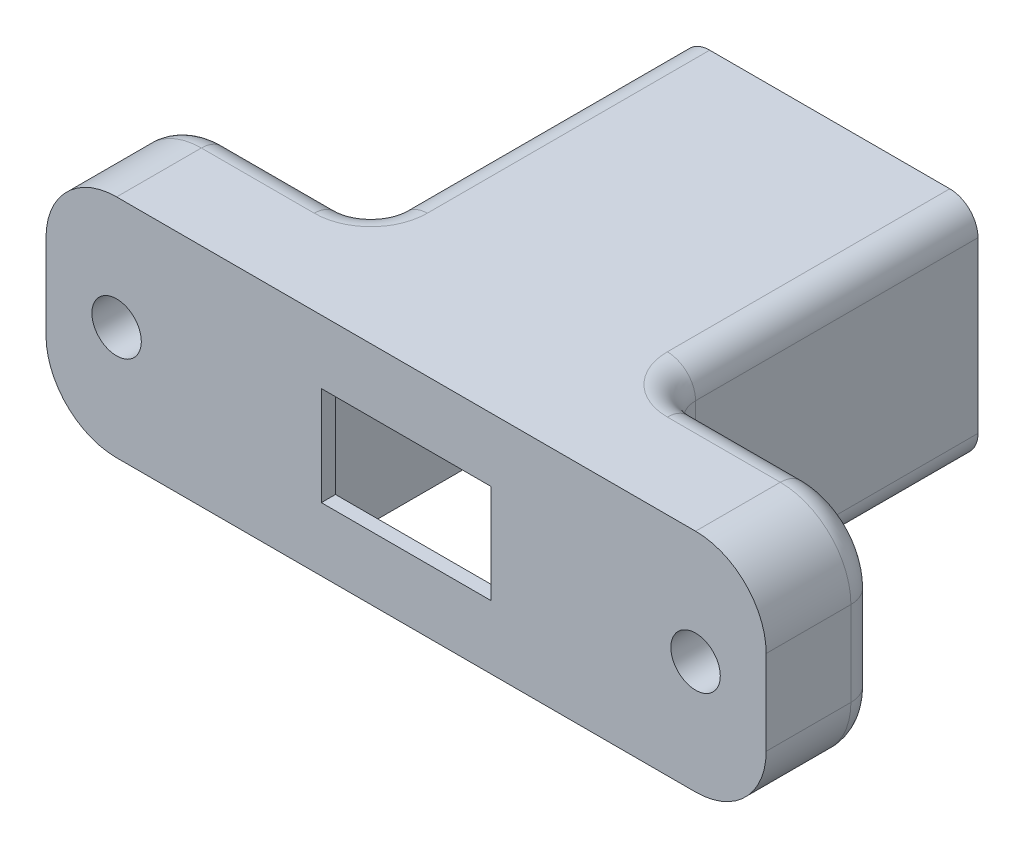
from build123d import *

# Parameters (mm, degrees)
SKETCH1_W           = 15
SKETCH1_H           = 10
SKETCH1_W_2         = 12
SKETCH1_H_2         = 7
SKETCH1_H_3         = 3
SKETCH1_R           = 1.75
BOSS_EXTRUDE1_DEPTH = 1
BOSS_EXTRUDE2_DEPTH = 24
BOSS_EXTRUDE3_START = -7
SKETCH1_5_R         = 1.75
BOSS_EXTRUDE3_DEPTH = 7
BOSS_EXTRUDE4_DEPTH = 5
CUT_EXTRUDE1_DEPTH  = 20
FILLET1_R           = 2


with BuildPart() as part:
    # Sketch1 → Boss-Extrude1 (new body)
    # profile 1 of 7: a face of its own
    with BuildSketch(Plane.XY):
        with Locations((7.5, 5)):
            Rectangle(SKETCH1_W, SKETCH1_H)
        with Locations((7.5, 5)):
            Rectangle(SKETCH1_W_2, SKETCH1_H_2, mode=Mode.SUBTRACT)
    # profile 2 of 7: a face of its own
    with BuildSketch(Plane.XY):
        with Locations((7.5, -1.5)):
            Rectangle(SKETCH1_W, SKETCH1_H_3)
    # profile 3 of 7: a face of its own
    with BuildSketch(Plane.XY):
        Polygon((0, -3), (0, 0), (0, 10), (15, 10), (15, 0), (15, -3), (18, -3), (18, 13), (-3, 13), (-3, -3), align=None)
    # profile 4 of 7: a face of its own
    with BuildSketch(Plane.XY):
        with BuildLine():
            Line((-13, -3), (-3, -3))
            Line((-3, -3), (-3, 13))
            Line((-3, 13), (-13, 13))
            ThreePointArc((-13, 13), (-16.535533906, 11.535533906), (-18, 8))
            Line((-18, 8), (-18, 2))
            ThreePointArc((-18, 2), (-16.535533906, -1.535533906), (-13, -3))
        make_face()
        Polygon((-11.383419246, 7.8), (-9.766838493, 5), (-11.383419246, 2.2), (-14.616580754, 2.2), (-16.233161507, 5), (-14.616580754, 7.8), align=None, mode=Mode.SUBTRACT)
    # profile 5 of 7: a face of its own
    with BuildSketch(Plane.XY):
        Polygon((-14.616580754, 2.2), (-11.383419246, 2.2), (-9.766838493, 5), (-11.383419246, 7.8), (-14.616580754, 7.8), (-16.233161507, 5), align=None)
        with Locations((-13, 5)):
            Circle(SKETCH1_R, mode=Mode.SUBTRACT)
    # profile 6 of 7: a face of its own
    with BuildSketch(Plane.XY):
        with BuildLine():
            Line((18, 13), (18, -3))
            Line((18, -3), (28, -3))
            ThreePointArc((28, -3), (31.535533906, -1.535533906), (33, 2))
            Line((33, 2), (33, 8))
            ThreePointArc((33, 8), (31.535533906, 11.535533906), (28, 13))
            Line((28, 13), (18, 13))
        make_face()
        Polygon((26.383419246, 2.2), (24.766838493, 5), (26.383419246, 7.8), (29.616580754, 7.8), (31.233161507, 5), (29.616580754, 2.2), align=None, mode=Mode.SUBTRACT)
    # profile 7 of 7: a face of its own
    with BuildSketch(Plane.XY):
        Polygon((29.616580754, 7.8), (26.383419246, 7.8), (24.766838493, 5), (26.383419246, 2.2), (29.616580754, 2.2), (31.233161507, 5), align=None)
        with Locations((28, 5)):
            Circle(SKETCH1_R, mode=Mode.SUBTRACT)
    extrude(amount=BOSS_EXTRUDE1_DEPTH)

    # Sketch1<4> → Boss-Extrude2 (add)
    with BuildSketch(Plane.XY):
        Polygon((0, -3), (0, 0), (0, 10), (15, 10), (15, 0), (15, -3), (18, -3), (18, 13), (-3, 13), (-3, -3), align=None)
    extrude(amount=-BOSS_EXTRUDE2_DEPTH)

    # Sketch1<5> → Boss-Extrude3 (add)
    # profile 1 of 4: a face of its own
    with BuildSketch(Plane.XY.offset(BOSS_EXTRUDE3_START)):
        with BuildLine():
            Line((18, 13), (18, -3))
            Line((18, -3), (28, -3))
            ThreePointArc((28, -3), (31.535533906, -1.535533906), (33, 2))
            Line((33, 2), (33, 8))
            ThreePointArc((33, 8), (31.535533906, 11.535533906), (28, 13))
            Line((28, 13), (18, 13))
        make_face()
        Polygon((26.383419246, 2.2), (24.766838493, 5), (26.383419246, 7.8), (29.616580754, 7.8), (31.233161507, 5), (29.616580754, 2.2), align=None, mode=Mode.SUBTRACT)
    # profile 2 of 4: a face of its own
    with BuildSketch(Plane.XY.offset(BOSS_EXTRUDE3_START)):
        Polygon((29.616580754, 7.8), (26.383419246, 7.8), (24.766838493, 5), (26.383419246, 2.2), (29.616580754, 2.2), (31.233161507, 5), align=None)
        with Locations((28, 5)):
            Circle(SKETCH1_5_R, mode=Mode.SUBTRACT)
    # profile 3 of 4: a face of its own
    with BuildSketch(Plane.XY.offset(BOSS_EXTRUDE3_START)):
        with BuildLine():
            Line((-13, -3), (-3, -3))
            Line((-3, -3), (-3, 13))
            Line((-3, 13), (-13, 13))
            ThreePointArc((-13, 13), (-16.535533906, 11.535533906), (-18, 8))
            Line((-18, 8), (-18, 2))
            ThreePointArc((-18, 2), (-16.535533906, -1.535533906), (-13, -3))
        make_face()
        Polygon((-11.383419246, 7.8), (-9.766838493, 5), (-11.383419246, 2.2), (-14.616580754, 2.2), (-16.233161507, 5), (-14.616580754, 7.8), align=None, mode=Mode.SUBTRACT)
    # profile 4 of 4: a face of its own
    with BuildSketch(Plane.XY.offset(BOSS_EXTRUDE3_START)):
        Polygon((-14.616580754, 2.2), (-11.383419246, 2.2), (-9.766838493, 5), (-11.383419246, 7.8), (-14.616580754, 7.8), (-16.233161507, 5), align=None)
        with Locations((-13, 5)):
            Circle(SKETCH1_5_R, mode=Mode.SUBTRACT)
    extrude(amount=BOSS_EXTRUDE3_DEPTH)

    # Sketch2 → Boss-Extrude4 (add)
    with BuildSketch(Plane(origin=(0, 0, -24), x_dir=(-1, 0, 0), z_dir=(0, 0, -1))):
        Polygon((-18, -3), (-15, -3), (-15, 10), (0, 10), (0, -3), (3, -3), (3, 13), (-18, 13), align=None)
        Polygon((-4.316136934, 6.453621675), (0, -3), (0, 10), (-5.935268204, 10), align=None)
        Polygon((-15, 10), (-15, -3), (-10.683863071, 6.453621665), (-9.064731796, 10), align=None)
    extrude(amount=BOSS_EXTRUDE4_DEPTH)

    # Sketch2<4> → Cut-Extrude1 (cut)
    with BuildSketch(Plane(origin=(0, 0, -24), x_dir=(-1, 0, 0), z_dir=(0, 0, -1))):
        Polygon((14.616580754, 7.8), (11.383419246, 7.8), (9.766838493, 5), (11.383419246, 2.2), (14.616580754, 2.2), (16.233161507, 5), align=None)
        Polygon((-29.616580754, 2.2), (-26.383419246, 2.2), (-24.766838493, 5), (-26.383419246, 7.8), (-29.616580754, 7.8), (-31.233161507, 5), align=None)
    extrude(amount=-CUT_EXTRUDE1_DEPTH, mode=Mode.SUBTRACT)

    # Fillet1
    # the kernel refuses this fillet: 2 mm, written as the material it adds along each edge
    with BuildSketch(Plane(origin=(18, 13, -7), x_dir=(1, 0, 0), z_dir=(0, -1, 0)), Plane(origin=(-3, -3, -7), x_dir=(-1, 0, 0), z_dir=(0, 1, 0))) as fillet1_piece_1:
        with BuildLine():
            CenterArc((FILLET1_R, -FILLET1_R), FILLET1_R, 90, 90)
            Line((0, -FILLET1_R), (0, 0))
            Line((0, 0), (FILLET1_R, 0))
        make_face()
    extrude(amount=16)
    # the kernel refuses this fillet: 2 mm, written as the material it takes off along each edge
    with BuildSketch(Plane(origin=(-3, -3, -9), x_dir=(1, 0, 0), z_dir=(0, 0, -1)), Plane(origin=(-3, 13, -34), x_dir=(1, 0, 0), z_dir=(0, 0, 1)), Plane(origin=(18, 13, -9), x_dir=(-1, 0, 0), z_dir=(0, 0, -1)), Plane(origin=(18, -3, -34), x_dir=(-1, 0, 0), z_dir=(0, 0, 1))) as fillet1_2_piece_1:
        with BuildLine():
            CenterArc((FILLET1_R, -FILLET1_R), FILLET1_R, 90, 90)
            Line((0, -FILLET1_R), (0, 0))
            Line((0, 0), (FILLET1_R, 0))
        make_face()
    extrude(amount=25, mode=Mode.SUBTRACT)
    with BuildSketch(Plane(origin=(28, 2, -7), x_dir=(0, -1, 0), z_dir=(-1, 0, 0))) as fillet1_2_piece_2:
        with BuildLine():
            CenterArc((5 - FILLET1_R, FILLET1_R), FILLET1_R, 270, 90)
            Line((5 - FILLET1_R, 0), (5, 0))
            Line((5, 0), (5, FILLET1_R))
        make_face()
    revolve(axis=Axis((28, 2, -7), (0, 0, 1)), revolution_arc=90, mode=Mode.SUBTRACT)
    with BuildSketch(Plane(origin=(20, -3, -7), x_dir=(0, 0, 1), z_dir=(1, 0, 0)), Plane(origin=(28, 13, -7), x_dir=(0, 0, 1), z_dir=(-1, 0, 0)), Plane(origin=(-13, -3, -7), x_dir=(0, 0, 1), z_dir=(1, 0, 0)), Plane(origin=(-5, 13, -7), x_dir=(0, 0, 1), z_dir=(-1, 0, 0))) as fillet1_2_piece_3:
        with BuildLine():
            CenterArc((FILLET1_R, -FILLET1_R), FILLET1_R, 90, 90)
            Line((0, -FILLET1_R), (0, 0))
            Line((0, 0), (FILLET1_R, 0))
        make_face()
    extrude(amount=8, mode=Mode.SUBTRACT)
    with BuildSketch(Plane(origin=(28, 8, -7), x_dir=(1, 0, 0), z_dir=(0, -1, 0))) as fillet1_2_piece_4:
        with BuildLine():
            CenterArc((5 - FILLET1_R, FILLET1_R), FILLET1_R, 270, 90)
            Line((5 - FILLET1_R, 0), (5, 0))
            Line((5, 0), (5, FILLET1_R))
        make_face()
    revolve(axis=Axis((28, 8, -7), (0, 0, 1)), revolution_arc=90, mode=Mode.SUBTRACT)
    with BuildSketch(Plane(origin=(33, 2, -7), x_dir=(0, 0, 1), z_dir=(0, 1, 0)), Plane(origin=(-18, 8, -7), x_dir=(0, 0, 1), z_dir=(0, -1, 0))) as fillet1_2_piece_5:
        with BuildLine():
            CenterArc((FILLET1_R, -FILLET1_R), FILLET1_R, 90, 90)
            Line((0, -FILLET1_R), (0, 0))
            Line((0, 0), (FILLET1_R, 0))
        make_face()
    extrude(amount=6, mode=Mode.SUBTRACT)
    with BuildSketch(Plane(origin=(-13, 2, -7), x_dir=(-1, 0, 0), z_dir=(0, 1, 0))) as fillet1_2_piece_6:
        with BuildLine():
            CenterArc((5 - FILLET1_R, FILLET1_R), FILLET1_R, 270, 90)
            Line((5 - FILLET1_R, 0), (5, 0))
            Line((5, 0), (5, FILLET1_R))
        make_face()
    revolve(axis=Axis((-13, 2, -7), (0, 0, 1)), revolution_arc=90, mode=Mode.SUBTRACT)
    with BuildSketch(Plane(origin=(-13, 8, -7), x_dir=(0, 1, 0), z_dir=(1, 0, 0))) as fillet1_2_piece_7:
        with BuildLine():
            CenterArc((5 - FILLET1_R, FILLET1_R), FILLET1_R, 270, 90)
            Line((5 - FILLET1_R, 0), (5, 0))
            Line((5, 0), (5, FILLET1_R))
        make_face()
    revolve(axis=Axis((-13, 8, -7), (0, 0, 1)), revolution_arc=90, mode=Mode.SUBTRACT)
    with BuildSketch(Plane(origin=(-5, 13, -9), x_dir=(0, 0, 1), z_dir=(-1, 0, 0))) as fillet1_2_piece_8:
        with BuildLine():
            CenterArc((2 + FILLET1_R, -FILLET1_R), FILLET1_R, 90, 90)
            Line((2, -FILLET1_R), (2, 0))
            Line((2, 0), (2 + FILLET1_R, 0))
        make_face()
    revolve(axis=Axis((-5, 13, -9), (0, 1, 0)), revolution_arc=90, mode=Mode.SUBTRACT)
    with BuildSketch(Plane(origin=(-5, -3, -9), x_dir=(0, 0, 1), z_dir=(-1, 0, 0))) as fillet1_2_piece_9:
        with BuildLine():
            CenterArc((2 + FILLET1_R, FILLET1_R), FILLET1_R, 180, 90)
            Line((2, FILLET1_R), (2, 0))
            Line((2, 0), (2 + FILLET1_R, 0))
        make_face()
    revolve(axis=Axis((-5, -3, -9), (0, 1, 0)), revolution_arc=90, mode=Mode.SUBTRACT)
    with BuildSketch(Plane(origin=(20, 13, -9), x_dir=(0, 0, 1), z_dir=(1, 0, 0))) as fillet1_2_piece_10:
        with BuildLine():
            CenterArc((2 + FILLET1_R, FILLET1_R), FILLET1_R, 180, 90)
            Line((2, FILLET1_R), (2, 0))
            Line((2, 0), (2 + FILLET1_R, 0))
        make_face()
    revolve(axis=Axis((20, 13, -9), (0, -1, 0)), revolution_arc=90, mode=Mode.SUBTRACT)
    with BuildSketch(Plane(origin=(20, -3, -9), x_dir=(0, 0, 1), z_dir=(1, 0, 0))) as fillet1_2_piece_11:
        with BuildLine():
            CenterArc((2 + FILLET1_R, -FILLET1_R), FILLET1_R, 90, 90)
            Line((2, -FILLET1_R), (2, 0))
            Line((2, 0), (2 + FILLET1_R, 0))
        make_face()
    revolve(axis=Axis((20, -3, -9), (0, -1, 0)), revolution_arc=90, mode=Mode.SUBTRACT)


solid = part.part
